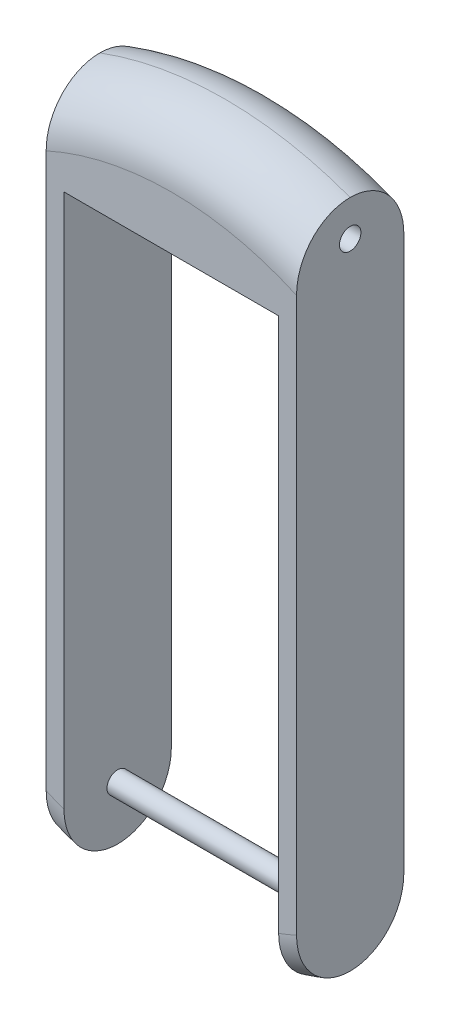
from build123d import *

# Parameters (mm, degrees)
EXTRUDE_1_DEPTH     = 30
SKETCH_2_R          = 3
CUT_EXTRUDE_1_DEPTH = 192
FILLET_1_R          = 15
CUT_EXTRUDE_2_DEPTH = 192
SKETCH_4_R          = 3
EXTRUDE_2_DEPTH     = 66
FILLET_2_R          = 15
FILLET_3_R          = 15
FILLET_4_R          = 15
FILLET_5_R          = 15
FILLET_8_ANGLE      = 6.858136


with BuildPart() as part:
    # 草图1 → 凸台-拉伸1 (new body)
    with BuildSketch(Plane.XY):
        with BuildLine():
            Line((35, -93.674969976), (35, 93.674969976))
            ThreePointArc((35, 93.674969976), (0, 100), (-35, 93.674969976))
            Line((-35, 93.674969976), (-35, -93.674969976))
            ThreePointArc((-35, -93.674969976), (0, -100), (35, -93.674969976))
        make_face()
    extrude(amount=EXTRUDE_1_DEPTH)

    # 草图2 → 切除-拉伸1 (cut)
    with BuildSketch(Plane(origin=(35, 0, 0), x_dir=(0, 0, -1), z_dir=(1, 0, 0))):
        with Locations((-15, 83.674969976)):
            Circle(SKETCH_2_R)
    extrude(amount=-CUT_EXTRUDE_1_DEPTH, mode=Mode.SUBTRACT)

    # 圆角1
    fillet_1_edges = [part.edges().sort_by_distance(p)[0] for p in [
        (0, 100, 0),
    ]]
    fillet(fillet_1_edges, radius=FILLET_1_R)

    # 草图3 → 切除-拉伸2 (cut)
    with BuildSketch(Plane.XY.offset(30)):
        Polygon((0, -100), (-30, -100), (-30, 70), (30, 70), (30, -100), align=None)
    extrude(amount=-CUT_EXTRUDE_2_DEPTH, mode=Mode.SUBTRACT)

    # 草图4 → 凸台-拉伸2 (add)
    with BuildSketch(Plane(origin=(35, 0, 0), x_dir=(0, 0, -1), z_dir=(1, 0, 0))):
        with Locations((-15, -80.393920142)):
            Circle(SKETCH_4_R)
    extrude(amount=-EXTRUDE_2_DEPTH)

    # 圆角2
    fillet_2_edges = [part.edges().sort_by_distance(p)[0] for p in [
        (0, 100, 30),
    ]]
    fillet(fillet_2_edges, radius=FILLET_2_R - 0.0001)  # a hair under: the kernel refuses the full size

    # 圆角3
    # the kernel refuses this fillet: 15 mm, written as the material it takes off along each edge
    with BuildSketch(Plane(origin=(0, 0, 30), x_dir=(-0.07024960756428812, -0.9975294444962832, 0), z_dir=(-0.9975294444962832, 0.07024960756428812, 0))) as fillet_3_piece_1:
        with BuildLine():
            CenterArc((100 - FILLET_3_R, -FILLET_3_R), FILLET_3_R, 0, 90)
            Line((100, -FILLET_3_R), (100, 0))
            Line((100, 0), (100 - FILLET_3_R, 0))
        make_face()
    revolve(axis=Axis((0, 0, 30), (0, 0, 1)), revolution_arc=46.001566182, mode=Mode.SUBTRACT)

    # 圆角4
    # the kernel refuses this fillet: 15 mm, written as the material it takes off along each edge
    with BuildSketch(Plane(origin=(0, 0, 0), x_dir=(-0.07024960756429688, -0.9975294444962826, 0), z_dir=(-0.9975294444962826, 0.07024960756429688, 0))) as fillet_4_piece_1:
        with BuildLine():
            CenterArc((100 - FILLET_4_R, FILLET_4_R), FILLET_4_R, 270, 90)
            Line((100, FILLET_4_R), (100, 0))
            Line((100, 0), (100 - FILLET_4_R, 0))
        make_face()
    revolve(axis=Axis((0, 0, 0), (0, 0, 1)), revolution_arc=46.001566182, mode=Mode.SUBTRACT)

    # 圆角5
    # the kernel refuses this fillet: 15 mm, written as the material it takes off along each edge
    with BuildSketch(Plane(origin=(0, 0, 30), x_dir=(-0.668783476201052, -0.7434572361342896, 0), z_dir=(-0.7434572361342896, 0.668783476201052, 0))) as fillet_5_piece_1:
        with BuildLine():
            CenterArc((100 - FILLET_5_R, -FILLET_5_R), FILLET_5_R, 0, 90)
            Line((100 - FILLET_5_R, 0), (100, 0))
            Line((100, 0), (100, -FILLET_5_R))
        make_face()
    revolve(axis=Axis((0, 0, 30), (0, 0, 1)), revolution_arc=46.001566182, mode=Mode.SUBTRACT)

    # 圆角8: read off the stored shape, not the designer's step
    # 圆角8 outline → 圆角8 (revolve, cut)
    with BuildSketch(Plane(origin=(0, 0, 0), x_dir=(-0.4117647058823542, -0.911290199107627, 0), z_dir=(-0.911290199107627, 0.4117647058823542, 0))):
        with BuildLine():
            ThreePointArc((100, 15), (95.606601718, 4.393398282), (85, 0))
            Line((85, 0), (100, 0))
            Line((100, 0), (100, 15))
        make_face()
    revolve(axis=Axis((0, 0, 0), (0, 0, 1)), revolution_arc=FILLET_8_ANGLE, mode=Mode.SUBTRACT)


solid = part.part
